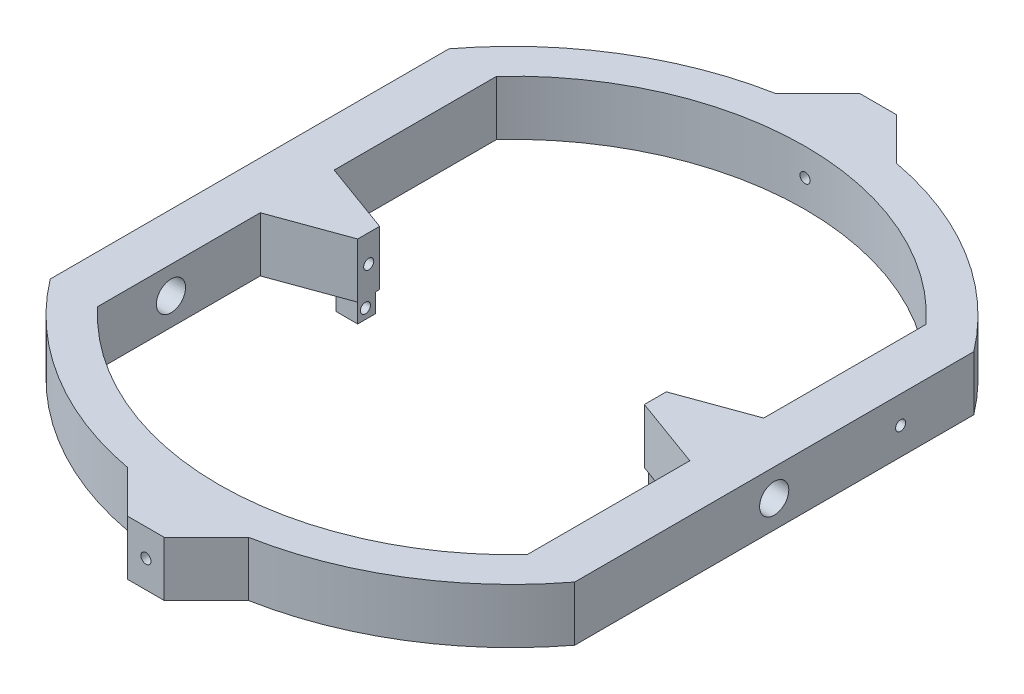
from build123d import *

# Parameters (mm, degrees)
BOSS_EXTRUDE1_DEPTH     = 19.05
SKETCH2_R               = 1.7526
CUT_EXTRUDE1_DEPTH      = 221.7
SKETCH3_R               = 5.08
CUT_EXTRUDE2_DEPTH      = 170.7
CIRPATTERN1_START       = -323.388650449
CIRPATTERN1_OUTLINE_R   = 5.08
CIRPATTERN1_DEPTH       = 29.913478247
CIRPATTERN1_START_2     = -293.475172202
CIRPATTERN1_2_OUTLINE_R = 1.7526
CIRPATTERN1_2_DEPTH     = 11.511586101
SKETCH5_R               = 1.7526
CUT_EXTRUDE3_DEPTH      = 295.91
SKETCH6_R               = 1.7526
CUT_EXTRUDE4_DEPTH      = 20.574
SKETCH7_R               = 5.08
CUT_EXTRUDE5_DEPTH      = 10.16
CIRPATTERN2_COUNT       = 2
SKETCH8_W               = 6.182053834
SKETCH8_H               = 6.581850062
SKETCH8_R               = 1.7526
BOSS_EXTRUDE2_DEPTH     = 7.62
CIRPATTERN3_COUNT       = 2


# Read off the part's stored shape, not the designer's step: CirPattern1
with BuildPart() as part:
    # Sketch1 → Boss-Extrude1 (new body)
    with BuildSketch(Plane(origin=(0, 0, 0), x_dir=(1, 0, 0), z_dir=(0, 1, 0))):
        with BuildLine():
            Line((-238.437586101, -1.254416157), (-253.074790503, -15.891620559))
            ThreePointArc((-253.074790503, -15.891620559), (-292.273480014, -31.022056532), (-323.388650449, -59.258797155))
            Line((-323.388650449, -59.258797155), (-323.388650449, -198.000222119))
            ThreePointArc((-323.388650449, -198.000222119), (-292.280058459, -226.218805317), (-253.09778688, -241.344364055))
            Line((-253.09778688, -241.344364055), (-253.074790503, -241.367360432))
            Line((-253.074790503, -241.367360432), (-238.437586101, -256.004564834))
            Line((-238.437586101, -256.004564834), (-225.737586101, -256.004564834))
            Line((-225.737586101, -256.004564834), (-211.100381699, -241.367360432))
            Line((-211.100381699, -241.367360432), (-211.077385322, -241.344364055))
            ThreePointArc((-211.077385322, -241.344364055), (-171.924255518, -226.236769292), (-140.827968899, -198.054719126))
            Line((-140.827968899, -198.054719126), (-140.827968899, -59.204261865))
            ThreePointArc((-140.827968899, -59.204261865), (-171.930845296, -31.004081905), (-211.100381699, -15.891620559))
            Line((-211.100381699, -15.891620559), (-225.737586101, -1.254416157))
            Line((-225.737586101, -1.254416157), (-238.437586101, -1.254416157))
        make_face()
        with BuildLine():
            Line((-281.963586101, -124.819490495), (-306.818249022, -115.773133009))
            Line((-306.818249022, -115.773133009), (-306.818249022, -59.258790155))
            ThreePointArc((-306.818249022, -59.258790155), (-232.087586101, -26.656188726), (-157.356923179, -59.258790155))
            Line((-157.356923179, -59.258790155), (-157.356923179, -115.773133009))
            Line((-157.356923179, -115.773133009), (-182.211586101, -124.819490495))
            Line((-182.211586101, -124.819490495), (-182.211586101, -132.439490495))
            Line((-182.211586101, -132.439490495), (-157.356923179, -141.485847982))
            Line((-157.356923179, -141.485847982), (-157.356923179, -198.054719126))
            ThreePointArc((-157.356923179, -198.054719126), (-232.087586101, -230.624332183), (-306.818249022, -198.054719126))
            Line((-306.818249022, -198.054719126), (-306.818249022, -141.485847982))
            Line((-306.818249022, -141.485847982), (-281.963586101, -132.439490495))
            Line((-281.963586101, -132.439490495), (-281.963586101, -124.819490495))
        make_face(mode=Mode.SUBTRACT)
    extrude(amount=BOSS_EXTRUDE1_DEPTH)

    # Sketch2 → Cut-Extrude1 (cut)
    with BuildSketch(Plane(origin=(0, 0, 0), x_dir=(0, 0, -1), z_dir=(1, 0, 0))):
        with Locations((-128.653847867, 9.576501184)):
            Circle(SKETCH2_R)
    extrude(amount=-CUT_EXTRUDE1_DEPTH, mode=Mode.SUBTRACT)

    # Sketch3 → Cut-Extrude2 (cut)
    with BuildSketch(Plane(origin=(0, 0, 0), x_dir=(0, 0, -1), z_dir=(1, 0, 0))):
        with Locations((-128.653847867, 9.576501184)):
            Circle(SKETCH3_R)
    extrude(amount=-CUT_EXTRUDE2_DEPTH, mode=Mode.SUBTRACT)

    # CirPattern1 outline → CirPattern1 (cut)
    with BuildSketch(Plane.YZ.offset(CIRPATTERN1_START)):
        with Locations((9.576501184, 128.605133124)):
            Circle(CIRPATTERN1_OUTLINE_R)
    extrude(amount=CIRPATTERN1_DEPTH, mode=Mode.SUBTRACT)

    # CirPattern1 2 outline → CirPattern1 2 (cut)
    with BuildSketch(Plane.YZ.offset(CIRPATTERN1_START_2)):
        with Locations((9.576501184, 128.605133124)):
            Circle(CIRPATTERN1_2_OUTLINE_R)
    extrude(amount=CIRPATTERN1_2_DEPTH, mode=Mode.SUBTRACT)

    # Sketch5 → Cut-Extrude3 (cut)
    with BuildSketch(Plane(origin=(0, 0, 1.254416157), x_dir=(-1, 0, 0), z_dir=(0, 0, -1))):
        with Locations((232.087586101, 9.525)):
            Circle(SKETCH5_R)
    extrude(amount=-CUT_EXTRUDE3_DEPTH, mode=Mode.SUBTRACT)

    # Sketch6 → Cut-Extrude4 (cut)
    with BuildSketch(Plane.ZY.offset(157.356923179)):
        with Locations((84.658797155, 9.525)):
            Circle(SKETCH6_R)
    cut_extrude4 = extrude(amount=-CUT_EXTRUDE4_DEPTH, mode=Mode.SUBTRACT)

    # Sketch7 → Cut-Extrude5 (cut)
    with BuildSketch(Plane.ZY.offset(157.356923179)):
        with Locations((84.658797155, 9.525)):
            Circle(SKETCH7_R)
    cut_extrude5 = extrude(amount=-CUT_EXTRUDE5_DEPTH, mode=Mode.SUBTRACT)

    # CirPattern2: Cut-Extrude4, Cut-Extrude5 ×2 about axis
    cirpattern2_axis = Axis((-232.087586101, 0, 128.605133124), (0, -1, 0))
    add([cut_extrude4.rotate(cirpattern2_axis, i * 360 / CIRPATTERN2_COUNT) for i in range(1, CIRPATTERN2_COUNT)], mode=Mode.SUBTRACT)
    add([cut_extrude5.rotate(cirpattern2_axis, i * 360 / CIRPATTERN2_COUNT) for i in range(1, CIRPATTERN2_COUNT)], mode=Mode.SUBTRACT)

    # Sketch8 → Boss-Extrude2 (add)
    with BuildSketch(Plane(origin=(-281.963586101, 0, 0), x_dir=(0, 0, -1), z_dir=(1, 0, 0))):
        with Locations((-129.348463578, -3.290925031)):
            Rectangle(SKETCH8_W, SKETCH8_H)
        with Locations((-129.752447072, -3.098573281)):
            Circle(SKETCH8_R, mode=Mode.SUBTRACT)
    boss_extrude2 = extrude(amount=-BOSS_EXTRUDE2_DEPTH)

    # CirPattern3: Boss-Extrude2 ×2 about axis
    cirpattern3_axis = Axis((-232.087586101, 0, 128.605133124), (0, 1, 0))
    for i in range(1, CIRPATTERN3_COUNT):
        add(boss_extrude2.rotate(cirpattern3_axis, i * 360 / CIRPATTERN3_COUNT))


solid = part.part
